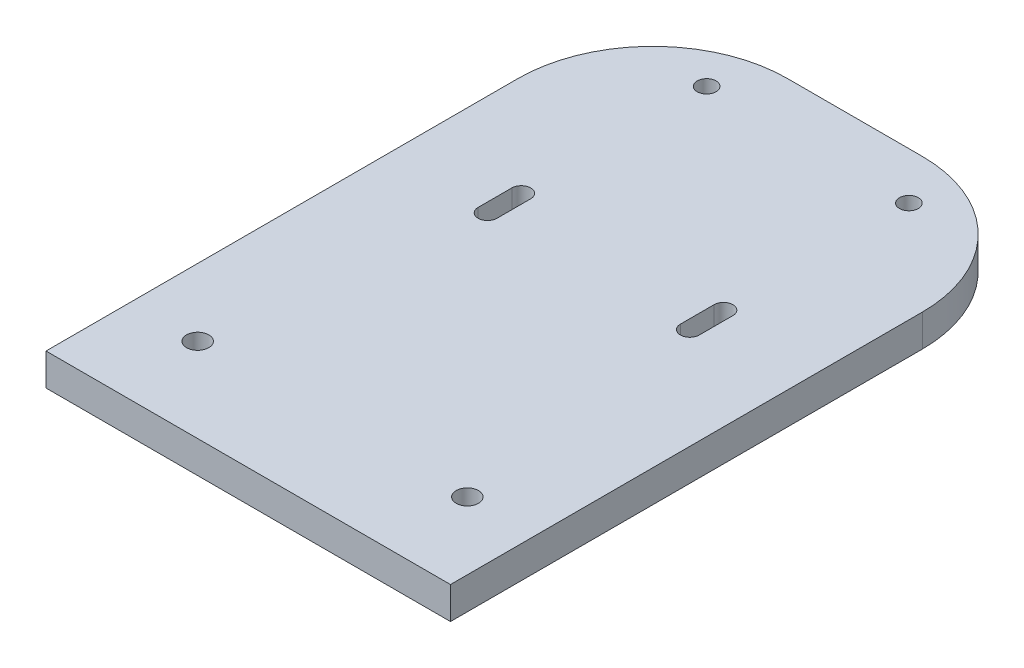
from build123d import *

# Parameters (mm, degrees)
SKETCH1_W           = 60
SKETCH1_H           = 90
BOSS_EXTRUDE1_DEPTH = 4.76
SKETCH2_R           = 1.65
SKETCH2_R_2         = 1.4
CUT_EXTRUDE1_DEPTH  = 109.2712224
FILLET1_R           = 20


with BuildPart() as part:
    # Sketch1 → Boss-Extrude1 (new body)
    with BuildSketch(Plane(origin=(0, 0, 0), x_dir=(1, 0, 0), z_dir=(0, 1, 0))):
        with Locations((30, 45)):
            Rectangle(SKETCH1_W, SKETCH1_H)
    extrude(amount=BOSS_EXTRUDE1_DEPTH)

    # Sketch2 → Cut-Extrude1 (cut, through all)
    with BuildSketch(Plane(origin=(0, 4.76, 0), x_dir=(1, 0, 0), z_dir=(0, 1, 0))):
        with Locations((10, 12.5)):
            Circle(SKETCH2_R)
        with Locations((50, 12.5)):
            Circle(SKETCH2_R)
        with Locations((15, 83)):
            Circle(SKETCH2_R_2)
        with Locations((45, 83)):
            Circle(SKETCH2_R_2)
        with BuildLine():
            Line((16.4, 55.5), (16.4, 50.5))
            ThreePointArc((16.4, 50.5), (15, 49.1), (13.6, 50.5))
            Line((13.6, 50.5), (13.6, 55.5))
            ThreePointArc((13.6, 55.5), (15, 56.9), (16.4, 55.5))
        make_face()
        with BuildLine():
            Line((43.6, 55.5), (43.6, 50.5))
            ThreePointArc((43.6, 50.5), (45, 49.1), (46.4, 50.5))
            Line((46.4, 50.5), (46.4, 55.5))
            ThreePointArc((46.4, 55.5), (45, 56.9), (43.6, 55.5))
        make_face()
    extrude(amount=-CUT_EXTRUDE1_DEPTH, mode=Mode.SUBTRACT)

    # Fillet1
    fillet1_edges = [part.edges().sort_by_distance(p)[0] for p in [
        (60, 2.38, -90),
        (0, 2.38, -90),
    ]]
    fillet(fillet1_edges, radius=FILLET1_R)


solid = part.part
